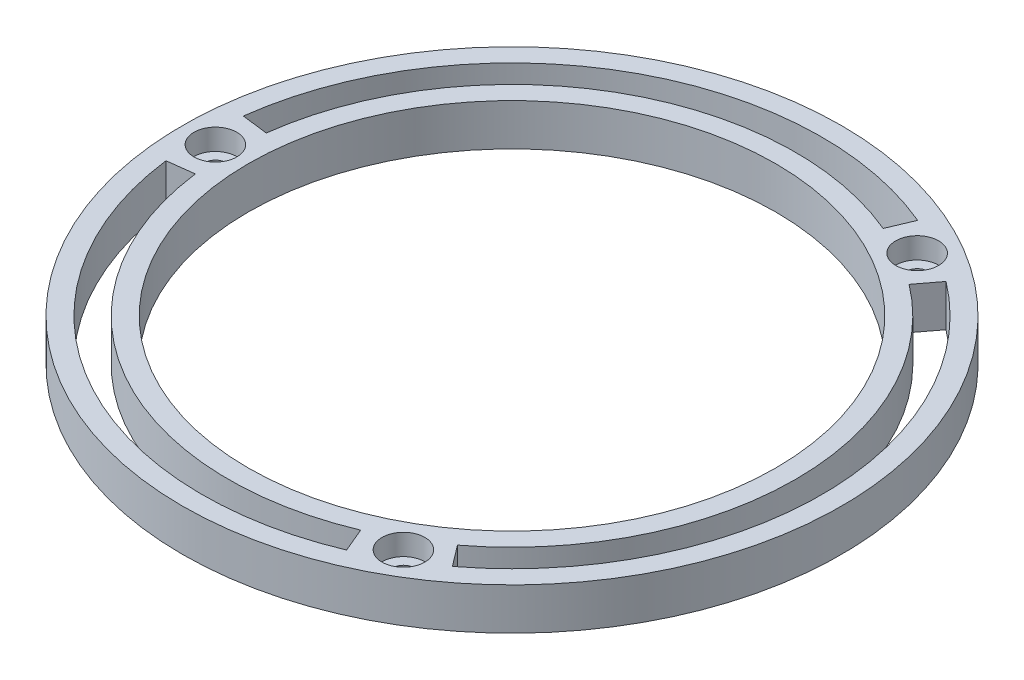
from build123d import *

# Parameters (mm, degrees)
SKETCH1_R           = 50
SKETCH1_R_2         = 40
BOSS_EXTRUDE1_DEPTH = 6.35
M3_HOLES_REACH      = 72.995
SKETCH2_R           = 1.65
SKETCH3_R           = 3.25
CUT_EXTRUDE1_DEPTH  = 3.2


with BuildPart() as part:
    # Sketch1 → Boss-Extrude1 (new body)
    with BuildSketch(Plane(origin=(0, 0, 0), x_dir=(1, 0, 0), z_dir=(0, 1, 0))):
        Circle(SKETCH1_R)
        with BuildLine():
            Line((28.403582676, -37.446448312), (25.986256491, -34.259516541))
            ThreePointArc((25.986256491, -34.259516541), (43, 0), (25.986256491, 34.259516541))
            Line((25.986256491, 34.259516541), (28.403582676, 37.446448312))
            ThreePointArc((28.403582676, 37.446448312), (47, 0), (28.403582676, -37.446448312))
        make_face(mode=Mode.SUBTRACT)
        with BuildLine():
            ThreePointArc((18.227784182, -43.321448312), (-23.5, -40.703193978), (-46.631366858, -5.875))
            Line((-46.631366858, -5.875), (-42.662739891, -5.375))
            ThreePointArc((-42.662739891, -5.375), (-21.5, -37.239092363), (16.6764834, -39.634516541))
            Line((16.6764834, -39.634516541), (18.227784182, -43.321448312))
        make_face(mode=Mode.SUBTRACT)
        with BuildLine():
            Line((18.227784182, 43.321448312), (16.6764834, 39.634516541))
            ThreePointArc((16.6764834, 39.634516541), (-21.5, 37.239092363), (-42.662739891, 5.375))
            Line((-42.662739891, 5.375), (-46.631366858, 5.875))
            ThreePointArc((-46.631366858, 5.875), (-23.5, 40.703193978), (18.227784182, 43.321448312))
        make_face(mode=Mode.SUBTRACT)
        Circle(SKETCH1_R_2, mode=Mode.SUBTRACT)
    extrude(amount=BOSS_EXTRUDE1_DEPTH)

    # Sketch2 → M3-holes (cut, up to next)
    with BuildSketch(Plane(origin=(0, 6.35, 0), x_dir=(1, 0, 0), z_dir=(0, 1, 0)), mode=Mode.PRIVATE) as m3_holes_sk1:
        with Locations((-45, 0)):
            Circle(SKETCH2_R)
    m3_holes_tool1 = extrude(m3_holes_sk1.sketch, amount=-M3_HOLES_REACH, mode=Mode.PRIVATE) & part.part
    # Sketch2 → M3-holes (cut, up to next)
    with BuildSketch(Plane(origin=(0, 6.35, 0), x_dir=(1, 0, 0), z_dir=(0, 1, 0)), mode=Mode.PRIVATE) as m3_holes_sk2:
        with Locations((22.5, -38.97114317)):
            Circle(SKETCH2_R)
    m3_holes_tool2 = extrude(m3_holes_sk2.sketch, amount=-M3_HOLES_REACH, mode=Mode.PRIVATE) & part.part
    # Sketch2 → M3-holes (cut, up to next)
    with BuildSketch(Plane(origin=(0, 6.35, 0), x_dir=(1, 0, 0), z_dir=(0, 1, 0)), mode=Mode.PRIVATE) as m3_holes_sk3:
        with Locations((22.5, 38.97114317)):
            Circle(SKETCH2_R)
    m3_holes_tool3 = extrude(m3_holes_sk3.sketch, amount=-M3_HOLES_REACH, mode=Mode.PRIVATE) & part.part
    add(m3_holes_tool1.solids().sort_by_distance((-45, 6.35, 0))[0], mode=Mode.SUBTRACT)
    add(m3_holes_tool2.solids().sort_by_distance((22.5, 6.35, 38.971143))[0], mode=Mode.SUBTRACT)
    add(m3_holes_tool3.solids().sort_by_distance((22.5, 6.35, -38.971143))[0], mode=Mode.SUBTRACT)

    # Sketch3 → Cut-Extrude1 (cut)
    with BuildSketch(Plane(origin=(0, 6.35, 0), x_dir=(1, 0, 0), z_dir=(0, 1, 0))):
        with Locations((-45, 0)):
            Circle(SKETCH3_R)
        with Locations((22.5, 38.97114317)):
            Circle(SKETCH3_R)
        with Locations((22.5, -38.97114317)):
            Circle(SKETCH3_R)
    extrude(amount=-CUT_EXTRUDE1_DEPTH, mode=Mode.SUBTRACT)


solid = part.part
